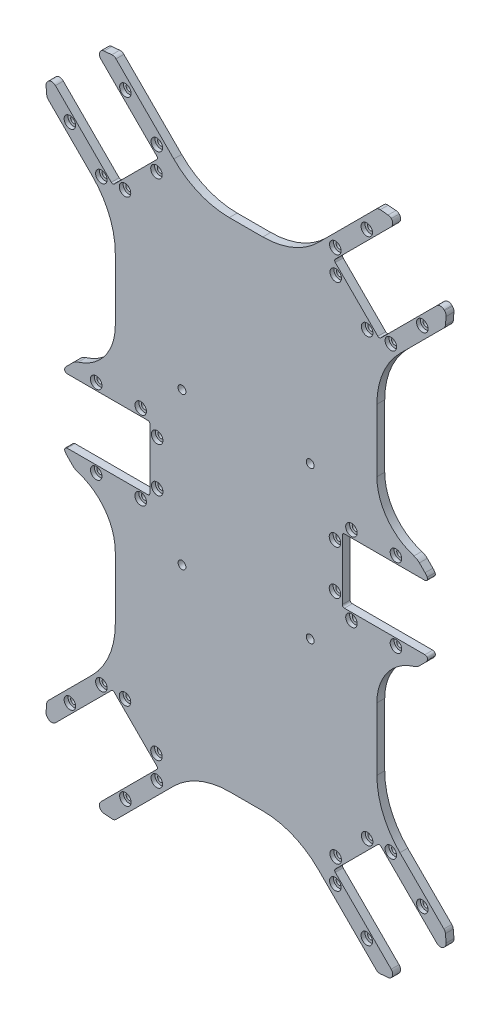
from build123d import *
from OCP.BRepFilletAPI import BRepFilletAPI_MakeChamfer

# Parameters (mm, degrees)
BOSS_EXTRUDE1_DEPTH                                 = 3
CUT_EXTRUDE1_DEPTH                                  = 151.82821928
CBORE_FOR_M2_HEX_SOCKET_HEAD_CAP_SCREW2_D           = 2.4
CBORE_FOR_M2_HEX_SOCKET_HEAD_CAP_SCREW2_CBORE_D     = 4.4
CBORE_FOR_M2_HEX_SOCKET_HEAD_CAP_SCREW2_CBORE_DEPTH = 1.5
SKETCH16_W                                          = 19.78
SKETCH16_H                                          = 6.2
BOSS_EXTRUDE2_DEPTH                                 = 3
CUT_EXTRUDE3_REACH                                  = 152.828
SKETCH21_W                                          = 13.22
SKETCH21_H                                          = 12.3
SKETCH14_R                                          = 1.5
CUT_EXTRUDE2_DEPTH                                  = 151.82821928
CBORE_FOR_M2_HEX_SOCKET_HEAD_CAP_SCREW4_D           = 2.4
CBORE_FOR_M2_HEX_SOCKET_HEAD_CAP_SCREW4_CBORE_D     = 4.4
CBORE_FOR_M2_HEX_SOCKET_HEAD_CAP_SCREW4_CBORE_DEPTH = 1.5
FILLET1_R                                           = 30
CHAMFER1_SIZE                                       = 3
CHAMFER1_SIZE2                                      = 3.575260778
FILLET2_R                                           = 2
FILLET3_R                                           = 0.8
CHAMFER2_SIZE                                       = 5
FILLET5_R                                           = 5
FILLET6_R                                           = 1
FILLET8_R                                           = 0.8
FILLET4_R                                           = 20


with BuildPart() as part:
    # Sketch3 → Boss-Extrude1 (new body)
    with BuildSketch(Plane.XY):
        Polygon((-52.495506858, 128.658457762), (-78.658457762, 102.495506858), (-50, 73.837049096), (-50, 0), (0, 0), (0, 95), (-18.837049096, 95), align=None)
    extrude(amount=BOSS_EXTRUDE1_DEPTH)

    # Sketch5 → Cut-Extrude1 (cut, through all)
    with BuildSketch(Plane.XY.offset(3)):
        Polygon((-33.545045122, 100.939871939), (-50.939871939, 83.545045122), (-77.314954878, 109.920128061), (-59.920128061, 127.314954878), align=None)
    extrude(amount=-CUT_EXTRUDE1_DEPTH, mode=Mode.SUBTRACT)

    # CBORE for M2 Hex Socket Head Cap Screw2 (through all)
    with Locations(Plane.XY.offset(3)):
        with Locations((-67.344749263, 96.131545827), (-55.323933983, 84.110730547), (-46.272967184, 84.252151903), (-34.252151903, 96.272967184), (-34.110730547, 105.323933983), (-46.131545827, 117.344749263)):
            CounterBoreHole(CBORE_FOR_M2_HEX_SOCKET_HEAD_CAP_SCREW2_D / 2, CBORE_FOR_M2_HEX_SOCKET_HEAD_CAP_SCREW2_CBORE_D / 2, CBORE_FOR_M2_HEX_SOCKET_HEAD_CAP_SCREW2_CBORE_DEPTH)

    # Sketch16 → Boss-Extrude2 (add)
    with BuildSketch(Plane.XY.offset(3)):
        with Locations((-59.89, 15.4)):
            Rectangle(SKETCH16_W, SKETCH16_H)
    extrude(amount=-BOSS_EXTRUDE2_DEPTH)

    # Sketch21 → Cut-Extrude3 (cut, up to next)
    with BuildSketch(Plane.XY.offset(3), mode=Mode.PRIVATE) as cut_extrude3_sk1:
        with Locations((-43.39, 6.15)):
            Rectangle(SKETCH21_W, SKETCH21_H)
    cut_extrude3_tool1 = extrude(cut_extrude3_sk1.sketch, amount=-CUT_EXTRUDE3_REACH, mode=Mode.PRIVATE) & part.part
    add(cut_extrude3_tool1.solids().sort_by_distance((-43.39, 6.15, 3))[0], mode=Mode.SUBTRACT)

    # Sketch14 → Cut-Extrude2 (cut, through all)
    with BuildSketch(Plane.XY.offset(3)):
        with Locations((-24.5, 29)):
            Circle(SKETCH14_R)
    extrude(amount=-CUT_EXTRUDE2_DEPTH, mode=Mode.SUBTRACT)

    # CBORE for M2 Hex Socket Head Cap Screw4 (through all)
    with Locations(Plane.XY.offset(3)):
        with Locations((-57.28, 15), (-40.28, 15), (-33.98, 8.5)):
            CounterBoreHole(CBORE_FOR_M2_HEX_SOCKET_HEAD_CAP_SCREW4_D / 2, CBORE_FOR_M2_HEX_SOCKET_HEAD_CAP_SCREW4_CBORE_D / 2, CBORE_FOR_M2_HEX_SOCKET_HEAD_CAP_SCREW4_CBORE_DEPTH)

    # Fillet1
    fillet1_edges = [part.edges().sort_by_distance(p)[0] for p in [
        (-18.837049096, 95, 1.5),
        (-50, 73.837049096, 1.5),
    ]]
    fillet(fillet1_edges, radius=FILLET1_R)

    # Chamfer1: one chamfer whose edges measure the first distance from different faces: ONE call of the kernel's chamfer builder (chamfer() names one face for all edges)
    chamfer1_edges_1 = [part.edges().sort_by_distance(p)[0] for p in [
        (-78.658457762, 102.495506858, 1.5),
    ]]
    chamfer1_side_1 = [part.faces().sort_by_distance(p)[0] for p in [
        (-76.46642674, 104.68753788, 1.5),
    ]]
    chamfer1_edges_2 = [part.edges().sort_by_distance(p)[0] for p in [
        (-52.495506858, 128.658457762, 1.5),
    ]]
    chamfer1_side_2 = [part.faces().sort_by_distance(p)[0] for p in [
        (-40.059676259, 116.222627163, 1.5),
    ]]
    chamfer1 = BRepFilletAPI_MakeChamfer(part.part.solid().wrapped)
    for e in chamfer1_edges_1:
        chamfer1.Add(CHAMFER1_SIZE, CHAMFER1_SIZE2, e.wrapped, chamfer1_side_1[0].wrapped)  # the first distance lies on this face
    for e in chamfer1_edges_2:
        chamfer1.Add(CHAMFER1_SIZE, CHAMFER1_SIZE2, e.wrapped, chamfer1_side_2[0].wrapped)  # the first distance lies on this face
    add(Compound.cast(chamfer1.Shape()), mode=Mode.REPLACE)

    # Fillet2
    # the kernel refuses this fillet: 2 mm, written as the material it takes off along each edge
    with BuildSketch(Plane(origin=(-55.023597999, 126.130366621, -1.819851171), x_dir=(0.9961946980917452, 0.08715574274766212, 0), z_dir=(0, 0, 1)), Plane(origin=(-76.130366621, 99.967415718, -1.819851171), x_dir=(-0.08715574274766041, 0.9961946980917452, 0), z_dir=(0, 0, 1))) as fillet2_piece_1:
        with BuildLine():
            CenterArc((FILLET2_R * 0.363970234266, -FILLET2_R), FILLET2_R, 90, 40)
            Line((-FILLET2_R * 0.27881737542, -FILLET2_R * 0.233955556881), (0, 0))
            Line((0, 0), (FILLET2_R * 0.363970234266, 0))
        make_face()
    extrude(amount=6.639702343, mode=Mode.SUBTRACT)
    with BuildSketch(Plane(origin=(-50.374186515, 126.537137418, -2.331538291), x_dir=(0.7071067811865476, -0.7071067811865476, 0), z_dir=(0, 0, 1)), Plane(origin=(-76.537137418, 104.616827202, -2.331538291), x_dir=(0.7071067811865399, 0.7071067811865552, 0), z_dir=(0, 0, 1))) as fillet2_piece_2:
        with BuildLine():
            CenterArc((FILLET2_R * 0.466307658155, -FILLET2_R), FILLET2_R, 90, 50)
            Line((-FILLET2_R * 0.299736784964, -FILLET2_R * 0.357212390313), (0, 0))
            Line((0, 0), (FILLET2_R * 0.466307658155, 0))
        make_face()
    extrude(amount=7.663076582, mode=Mode.SUBTRACT)
    with BuildSketch(Plane(origin=(-56.879568901, 124.274395719, 8), x_dir=(0.7071067811865493, 0.7071067811865458, 0), z_dir=(0, 0, -1))) as fillet2_piece_3:
        with BuildLine():
            CenterArc((FILLET2_R, FILLET2_R), FILLET2_R, 180, 90)
            Line((0, FILLET2_R), (0, 0))
            Line((0, 0), (FILLET2_R, 0))
        make_face()
    extrude(amount=13, mode=Mode.SUBTRACT)
    with BuildSketch(Plane(origin=(-74.274395719, 106.879568901, -5), x_dir=(0.7071067811865476, -0.7071067811865476, 0), z_dir=(0, 0, 1))) as fillet2_piece_4:
        with BuildLine():
            CenterArc((FILLET2_R, -FILLET2_R), FILLET2_R, 90, 90)
            Line((0, -FILLET2_R), (0, 0))
            Line((0, 0), (FILLET2_R, 0))
        make_face()
    extrude(amount=13, mode=Mode.SUBTRACT)

    # Fillet3
    fillet3_edges = [part.edges().sort_by_distance(p)[0] for p in [
        (-50.939871939, 83.545045122, 1.5),
        (-33.545045122, 100.939871939, 1.5),
    ]]
    fillet(fillet3_edges, radius=FILLET3_R)

    # Chamfer2
    chamfer2_edges = [part.edges().sort_by_distance(p)[0] for p in [
        (-69.78, 18.5, 1.5),
    ]]
    chamfer(chamfer2_edges, length=CHAMFER2_SIZE)

    # Fillet5
    # the kernel refuses this fillet: 5 mm, written as the material it takes off along each edge
    with BuildSketch(Plane(origin=(-69.78, 13.5, 7.845243271), x_dir=(0.7071067811865466, 0.7071067811865485, 0), z_dir=(0, 0, -1))) as fillet5_piece_1:
        with BuildLine():
            CenterArc((1.938097308, 5), FILLET5_R, 236.12898906, 33.87101094)
            Line((-0.848528137, 0.848528137), (-0.904260646, 0.7654987))
            ThreePointArc((-0.904260646, 0.7654987), (-0.494974747, 0.353553391), (-0.070710678, -0.070710678))
            Line((-0.070710678, -0.070710678), (0, -0.1))
            Line((0, -0.1), (1.938097308, -0.1))
            Line((1.938097308, -0.1), (1.938097308, 0))
        make_face()
    extrude(amount=12.690486541, mode=Mode.SUBTRACT)
    with BuildSketch(Plane(origin=(-64.78, 18.5, 8.17766953), x_dir=(1, 0, 0), z_dir=(0, 0, -1))) as fillet5_piece_2:
        with BuildLine():
            CenterArc((FILLET5_R * 0.414213562373, FILLET5_R), FILLET5_R, 225, 45)
            Line((-FILLET5_R * 0.292893218813, FILLET5_R * 0.292893218813), (-FILLET5_R * 0.307035354437, FILLET5_R * 0.27875108319))
            Line((-FILLET5_R * 0.307035354437, FILLET5_R * 0.27875108319), (-FILLET5_R * 0.00828427124746, -FILLET5_R * 0.02))
            Line((-FILLET5_R * 0.00828427124746, -FILLET5_R * 0.02), (FILLET5_R * 0.414213562373, -FILLET5_R * 0.02))
            Line((FILLET5_R * 0.414213562373, -FILLET5_R * 0.02), (FILLET5_R * 0.414213562373, 0))
        make_face()
    extrude(amount=13.355339059, mode=Mode.SUBTRACT)

    # Fillet6
    fillet6_edges = [part.edges().sort_by_distance(p)[0] for p in [
        (-69.78, 12.3, 1.5),
    ]]
    fillet(fillet6_edges, radius=FILLET6_R)

    # Fillet8
    fillet8_edges = [part.edges().sort_by_distance(p)[0] for p in [
        (-36.78, 12.3, 1.5),
    ]]
    fillet(fillet8_edges, radius=FILLET8_R)

    # Fillet4
    fillet4_edges = [part.edges().sort_by_distance(p)[0] for p in [
        (-50, 18.5, 1.5),
    ]]
    fillet(fillet4_edges, radius=FILLET4_R)

    # Mirror1: part across plane


with BuildPart() as part_1:
    add(part.part)
    add(part.part.mirror(Plane(origin=(0, 0, 0), x_dir=(0, 0, 1), z_dir=(1, 0, 0))))

    # Mirror2: part across plane


with BuildPart() as part_2:
    add(part_1.part)
    add(part_1.part.mirror(Plane.ZX))


solid = part_2.part
